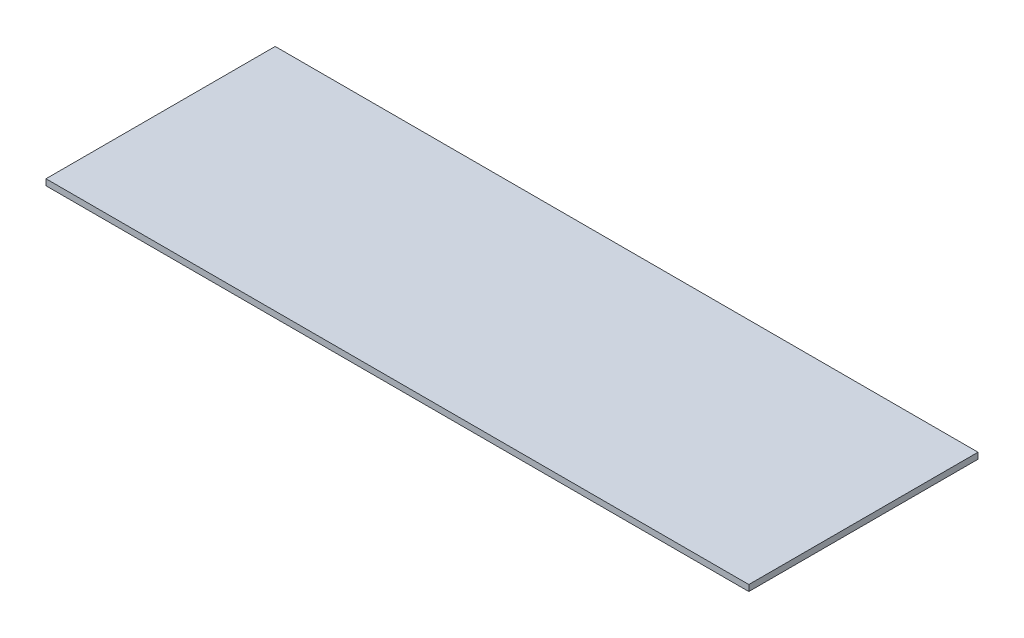
from build123d import *

# Parameters (mm, degrees)
SKETCH1_W           = 2300
SKETCH1_H           = 750
BOSS_EXTRUDE1_DEPTH = 20


with BuildPart() as part:
    # Sketch1 → Boss-Extrude1 (new body)
    with BuildSketch(Plane(origin=(0, 0, 0), x_dir=(1, 0, 0), z_dir=(0, 1, 0))):
        with Locations((1150, 375)):
            Rectangle(SKETCH1_W, SKETCH1_H)
    extrude(amount=BOSS_EXTRUDE1_DEPTH)


solid = part.part
